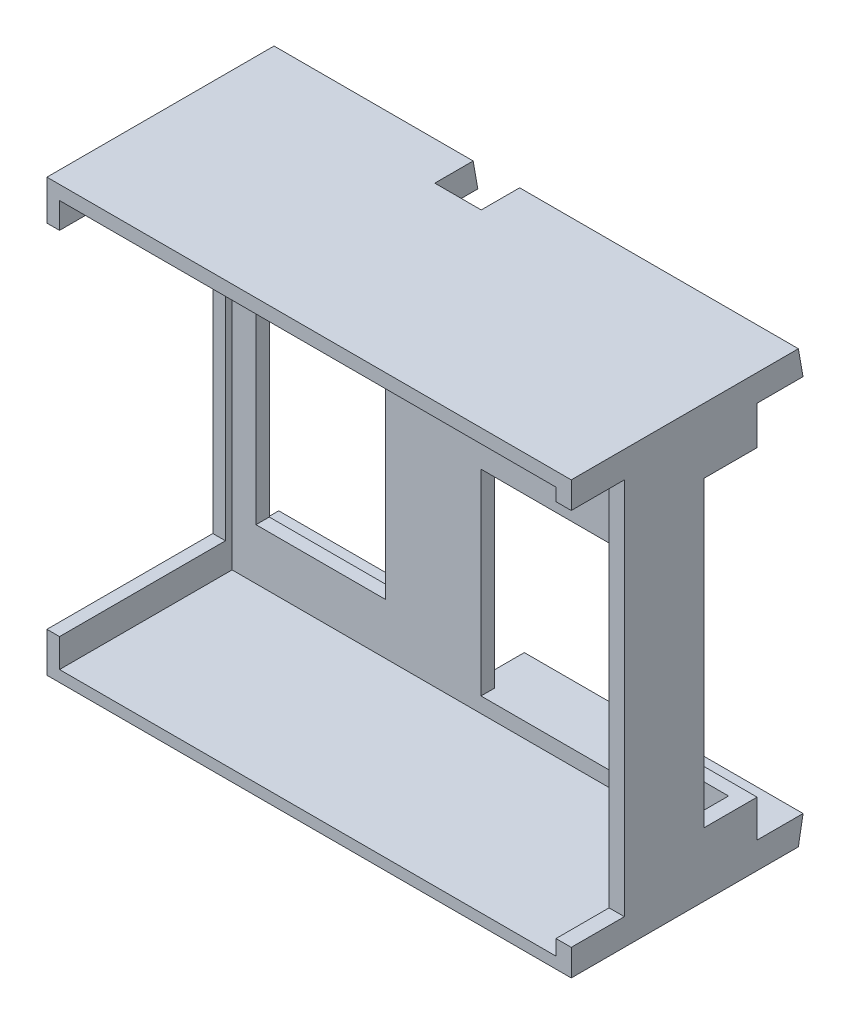
from build123d import *

# Parameters (mm, degrees)
ESQUISSE1_W              = 39.5
ESQUISSE1_H              = 32.5
BOSS_EXTRU_1_DEPTH       = 14
ESQUISSE2_W              = 37.4
ESQUISSE2_H              = 30.6
ENL_V_MAT_EXTRU_1_DEPTH  = 13
ESQUISSE3_W              = 4
ESQUISSE3_H              = 28.5
ENL_V_MAT_EXTRU_2_DEPTH  = 5
ESQUISSE4_W              = 12.5
ESQUISSE4_H              = 26.5
ENL_V_MAT_EXTRU_3_DEPTH  = 5
ESQUISSE6_W              = 14.8
ESQUISSE6_H              = 14.8
ENL_V_MAT_EXTRU_5_DEPTH  = 53.777836257
ESQUISSE7_W              = 9.75
ESQUISSE7_H              = 23.1
ENL_V_MAT_EXTRU_6_DEPTH  = 53.777836257
ESQUISSE8_W              = 4
ESQUISSE8_H              = 22.8
BOSS_EXTRU_3_DEPTH       = 1
ESQUISSE8_2_W            = 4
ESQUISSE8_2_H            = 22.8
ENL_V_MAT_EXTRU_7_DEPTH  = 1
ESQUISSE9_W              = 3
ESQUISSE9_H              = 22.8
ENL_V_MAT_EXTRU_9_DEPTH  = 1.2
BOSS_EXTRU_6_DEPTH       = 2
BOSS_EXTRU_7_DEPTH       = 2
ESQUISSE14_W             = 40
ESQUISSE14_H             = 9.401923789
ENL_V_MAT_EXTRU_10_DEPTH = 54.033008589
ESQUISSE15_W             = 3.5
ESQUISSE15_H             = 4
ENL_V_MAT_EXTRU_11_DEPTH = 54.033008589
CHANFREIN1_SIZE          = 0.352653961
CHANFREIN1_SIZE_2        = 2


with BuildPart() as part:
    # Esquisse1 → Boss.-Extru.1 (new body)
    with BuildSketch(Plane.XY):
        with Locations((19.75, 16.25)):
            Rectangle(ESQUISSE1_W, ESQUISSE1_H)
    extrude(amount=BOSS_EXTRU_1_DEPTH)

    # Esquisse2 → Enlèv. mat.-Extru.1 (cut)
    with BuildSketch(Plane.XY.offset(14)):
        with Locations((19.65, 16.15)):
            Rectangle(ESQUISSE2_W, ESQUISSE2_H)
    extrude(amount=-ENL_V_MAT_EXTRU_1_DEPTH, mode=Mode.SUBTRACT)

    # Esquisse3 → Enlèv. mat.-Extru.2 (cut)
    with BuildSketch(Plane(origin=(39.5, 0, 0), x_dir=(0, 0, -1), z_dir=(1, 0, 0))):
        with Locations((-12, 16.25)):
            Rectangle(ESQUISSE3_W, ESQUISSE3_H)
    extrude(amount=-ENL_V_MAT_EXTRU_2_DEPTH, mode=Mode.SUBTRACT)

    # Esquisse4 → Enlèv. mat.-Extru.3 (cut)
    with BuildSketch(Plane.ZY):
        with Locations((7.75, 16.25)):
            Rectangle(ESQUISSE4_W, ESQUISSE4_H)
    extrude(amount=-ENL_V_MAT_EXTRU_3_DEPTH, mode=Mode.SUBTRACT)

    # Esquisse6 → Enlèv. mat.-Extru.5 (cut, through all)
    with BuildSketch(Plane.XY.offset(1)):
        with Locations((27.1, 9.4)):
            Rectangle(ESQUISSE6_W, ESQUISSE6_H)
    extrude(amount=-ENL_V_MAT_EXTRU_5_DEPTH, mode=Mode.SUBTRACT)

    # Esquisse7 → Enlèv. mat.-Extru.6 (cut, through all)
    with BuildSketch(Plane.XY.offset(1)):
        with Locations((7.625, 16.25)):
            Rectangle(ESQUISSE7_W, ESQUISSE7_H)
    extrude(amount=-ENL_V_MAT_EXTRU_6_DEPTH, mode=Mode.SUBTRACT)

    # Esquisse8 → Boss.-Extru.3 (add)
    with BuildSketch(Plane(origin=(0, 0, 0), x_dir=(-1, 0, 0), z_dir=(0, 0, -1))):
        with Locations((-37.5, 16.2)):
            Rectangle(ESQUISSE8_W, ESQUISSE8_H)
    extrude(amount=-BOSS_EXTRU_3_DEPTH)

    # Esquisse8<2> → Enlèv. mat.-Extru.7 (cut)
    with BuildSketch(Plane(origin=(0, 0, 0), x_dir=(-1, 0, 0), z_dir=(0, 0, -1))):
        with Locations((-37.5, 16.2)):
            Rectangle(ESQUISSE8_2_W, ESQUISSE8_2_H)
    extrude(amount=-ENL_V_MAT_EXTRU_7_DEPTH, mode=Mode.SUBTRACT)

    # Esquisse9 → Enlèv. mat.-Extru.9 (cut)
    with BuildSketch(Plane(origin=(39.5, 0, 0), x_dir=(0, 0, -1), z_dir=(1, 0, 0))):
        with Locations((-2.5, 16.2)):
            Rectangle(ESQUISSE9_W, ESQUISSE9_H)
    extrude(amount=-ENL_V_MAT_EXTRU_9_DEPTH, mode=Mode.SUBTRACT)

    # Esquisse12 → Boss.-Extru.6 (add)
    with BuildSketch(Plane(origin=(0, 32.5, 0), x_dir=(1, 0, 0), z_dir=(0, 1, 0))):
        Polygon((0, 0), (-0.001437079, 12), (39.5, 10), (39.5, 0), align=None)
    extrude(amount=-BOSS_EXTRU_6_DEPTH)

    # Esquisse13 → Boss.-Extru.7 (add)
    with BuildSketch(Plane.XZ):
        Polygon((39.5, 0), (39.5, -9.999999903), (0, -12), (0, 0), align=None)
    extrude(amount=-BOSS_EXTRU_7_DEPTH)

    # Esquisse14 → Enlèv. mat.-Extru.10 (cut, through all)
    with BuildSketch(Plane(origin=(0, 0, 0), x_dir=(-1, 0, 0), z_dir=(0, -1, 0))):
        with Locations((-19.5, 8.165063509)):
            Rectangle(ESQUISSE14_W, ESQUISSE14_H)
    extrude(amount=-ENL_V_MAT_EXTRU_10_DEPTH, mode=Mode.SUBTRACT)

    # Esquisse15 → Enlèv. mat.-Extru.11 (cut, through all)
    with BuildSketch(Plane(origin=(0, 0, 0), x_dir=(-1, 0, 0), z_dir=(0, -1, 0))):
        with Locations((-16.75, 2.218139361)):
            Rectangle(ESQUISSE15_W, ESQUISSE15_H)
    extrude(amount=-ENL_V_MAT_EXTRU_11_DEPTH, mode=Mode.SUBTRACT)

    # Chanfrein1
    # the kernel refuses this chamfer: 2, 0.352653961 mm, written as the material it takes off along each edge
    with BuildSketch(Plane(origin=(-5.197077593, 0, -3.464101615), x_dir=(0, -0.21013876076743054, 0.9776715712462588), z_dir=(1, 0, 0))) as chanfrein1_piece_1:
        Polygon((CHANFREIN1_SIZE * 0.977671572402, -CHANFREIN1_SIZE * 0.210138761016), (-CHANFREIN1_SIZE_2 * 0.210138760767, -CHANFREIN1_SIZE_2 * 0.977671571246), (0, 0), align=None)
    extrude(amount=25.394155186, mode=Mode.SUBTRACT)
    with BuildSketch(Plane(origin=(13.302922407, 0, -3.464101615), x_dir=(0, -0.2101387607674303, 0.9776715712462589), z_dir=(1, 0, 0))) as chanfrein1_piece_2:
        Polygon((CHANFREIN1_SIZE * 0.977671572402, -CHANFREIN1_SIZE * 0.210138761016), (-CHANFREIN1_SIZE_2 * 0.210138760767, -CHANFREIN1_SIZE_2 * 0.977671571246), (0, 0), align=None)
    extrude(amount=31.394155186, mode=Mode.SUBTRACT)
    with BuildSketch(Plane(origin=(-5.197492442, 32.5, -3.464101615), x_dir=(0, 0.21013876076742352, 0.9776715712462605), z_dir=(1, 0, 0))) as chanfrein1_piece_3:
        Polygon((CHANFREIN1_SIZE * 0.977671572402, CHANFREIN1_SIZE * 0.210138761016), (-CHANFREIN1_SIZE_2 * 0.210138760767, CHANFREIN1_SIZE_2 * 0.977671571246), (0, 0), align=None)
    extrude(amount=25.394570035, mode=Mode.SUBTRACT)
    with BuildSketch(Plane(origin=(13.302922407, 32.5, -3.464101615), x_dir=(0, 0.21013876076742327, 0.9776715712462605), z_dir=(1, 0, 0))) as chanfrein1_piece_4:
        Polygon((CHANFREIN1_SIZE * 0.977671572402, CHANFREIN1_SIZE * 0.210138761016), (-CHANFREIN1_SIZE_2 * 0.210138760767, CHANFREIN1_SIZE_2 * 0.977671571246), (0, 0), align=None)
    extrude(amount=31.394155186, mode=Mode.SUBTRACT)


solid = part.part
